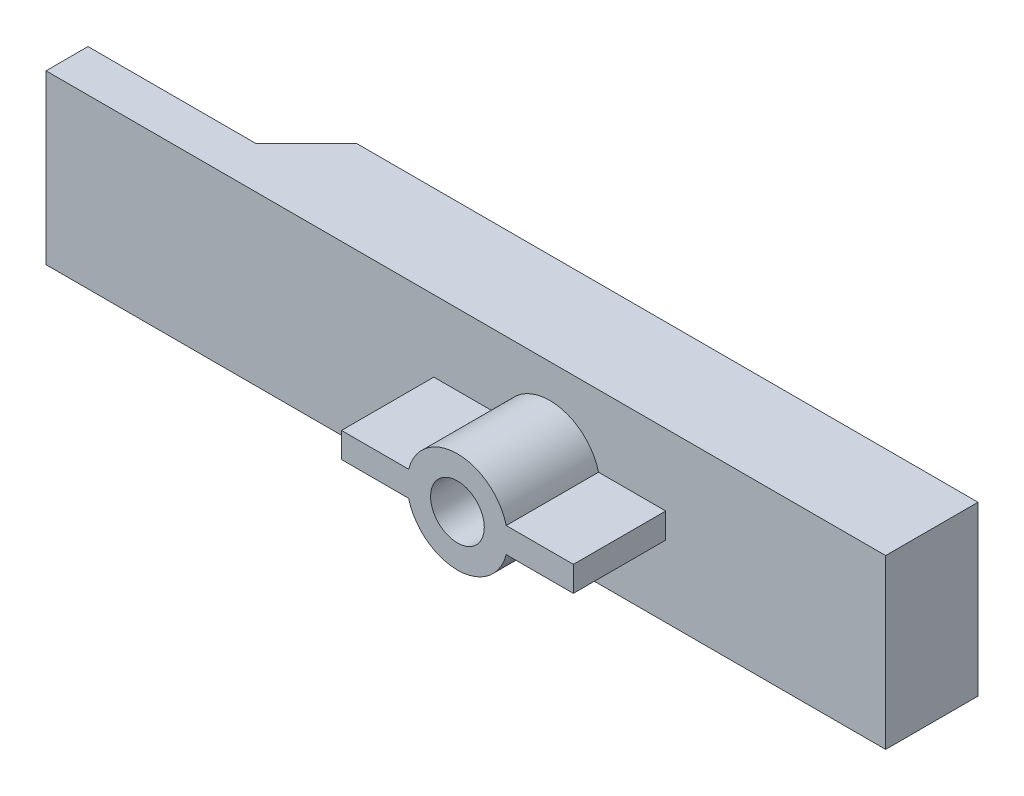
from build123d import *

# Parameters (mm, degrees)
SKETCH_1_W      = 40
SKETCH_1_H      = 10
EXTRUDE_1_DEPTH = 2.5
SKETCH_3_W      = 4
SKETCH_3_H      = 10
EXTRUDE_3_DEPTH = 3
SKETCH_4_W      = 15
SKETCH_4_H      = 1.5
SKETCH_4_W_2    = 3
SKETCH_4_H_2    = 3.5
EXTRUDE_4_DEPTH = 3
CHAMFER_1_SIZE  = 1.5
SKETCH_6_R      = 3
SKETCH_6_R_2    = 1.6
EXTRUDE_5_DEPTH = 5.5
SKETCH_7_W      = 2.5
SKETCH_7_H      = 10
EXTRUDE_6_DEPTH = 10
SKETCH_8_W      = 4
SKETCH_8_H      = 1.5
EXTRUDE_7_DEPTH = 5.5
SKETCH_9_W      = 33
SKETCH_9_H      = 10
EXTRUDE_8_DEPTH = 3
CHAMFER_2_SIZE  = 3


with BuildPart() as part:
    # 草图1 → 凸台-拉伸1 (new body)
    with BuildSketch(Plane.XY):
        with Locations((20, 5)):
            Rectangle(SKETCH_1_W, SKETCH_1_H)
    extrude(amount=EXTRUDE_1_DEPTH)

    # 草图3 → 凸台-拉伸3 (add)
    with BuildSketch(Plane(origin=(0, 0, 0), x_dir=(-1, 0, 0), z_dir=(0, 0, -1))):
        with Locations((-38, 5)):
            Rectangle(SKETCH_3_W, SKETCH_3_H)
    extrude(amount=EXTRUDE_3_DEPTH)

    # 草图4 → 凸台-拉伸4 (add)
    with BuildSketch(Plane(origin=(0, 0, 0), x_dir=(-1, 0, 0), z_dir=(0, 0, -1))):
        with Locations((-28.5, 5.75)):
            Rectangle(SKETCH_4_W, SKETCH_4_H)
        with Locations((-28.5, 4.25)):
            Rectangle(SKETCH_4_W, SKETCH_4_H)
        with Locations((-19.5, 5.75)):
            Rectangle(SKETCH_4_W_2, SKETCH_4_H)
        with Locations((-19.5, 4.25)):
            Rectangle(SKETCH_4_W_2, SKETCH_4_H)
        with Locations((-19.5, 8.25)):
            Rectangle(SKETCH_4_W_2, SKETCH_4_H_2)
        with Locations((-19.5, 1.75)):
            Rectangle(SKETCH_4_W_2, SKETCH_4_H_2)
        with Locations((-10.5, 5.75)):
            Rectangle(SKETCH_4_W, SKETCH_4_H)
        with Locations((-10.5, 4.25)):
            Rectangle(SKETCH_4_W, SKETCH_4_H)
        with Locations((-1.5, 5.75)):
            Rectangle(SKETCH_4_W_2, SKETCH_4_H)
        with Locations((-1.5, 4.25)):
            Rectangle(SKETCH_4_W_2, SKETCH_4_H)
        with Locations((-1.5, 8.25)):
            Rectangle(SKETCH_4_W_2, SKETCH_4_H_2)
        with Locations((-1.5, 1.75)):
            Rectangle(SKETCH_4_W_2, SKETCH_4_H_2)
    extrude(amount=EXTRUDE_4_DEPTH)

    # 倒角1
    chamfer_1_edges = [part.edges().sort_by_distance(p)[0] for p in [
        (10.5, 3.5, 0),
        (28.5, 3.5, 0),
    ]]
    chamfer(chamfer_1_edges, length=CHAMFER_1_SIZE)
    chamfer_1_2_edges = [part.edges().sort_by_distance(p)[0] for p in [
        (10.5, 3.5, -3),
        (28.5, 3.5, -3),
    ]]
    chamfer(chamfer_1_2_edges, length=CHAMFER_1_SIZE - 0.0001)  # a hair under: the kernel refuses the full size

    # 草图6 → 凸台-拉伸5 (add)
    with BuildSketch(Plane.XY.offset(2.5)):
        with Locations(Location((20, 5, 0), (0, 0, 180))):
            Circle(SKETCH_6_R)
        with Locations((20, 5)):
            Circle(SKETCH_6_R_2, mode=Mode.SUBTRACT)
    extrude(amount=EXTRUDE_5_DEPTH)

    # 草图7 → 凸台-拉伸6 (add)
    with BuildSketch(Plane.ZY):
        with Locations((1.25, 5)):
            Rectangle(SKETCH_7_W, SKETCH_7_H)
    extrude(amount=EXTRUDE_6_DEPTH)

    # 草图8 → 凸台-拉伸7 (add)
    with BuildSketch(Plane.XY.offset(2.5)):
        with Locations((15.09526249, 5)):
            Rectangle(SKETCH_8_W, SKETCH_8_H)
        with Locations((24.90473751, 5)):
            Rectangle(SKETCH_8_W, SKETCH_8_H)
    extrude(amount=EXTRUDE_7_DEPTH)

    # 草图9 → 凸台-拉伸8 (add)
    with BuildSketch(Plane(origin=(0, 0, 0), x_dir=(-1, 0, 0), z_dir=(0, 0, -1))):
        with Locations((-19.5, 5)):
            Rectangle(SKETCH_9_W, SKETCH_9_H)
    extrude(amount=EXTRUDE_8_DEPTH)

    # 倒角2
    chamfer_2_edges = [part.edges().sort_by_distance(p)[0] for p in [
        (0, 5, -3),
    ]]
    chamfer(chamfer_2_edges, length=CHAMFER_2_SIZE - 0.0001)  # a hair under: the kernel refuses the full size


solid = part.part
